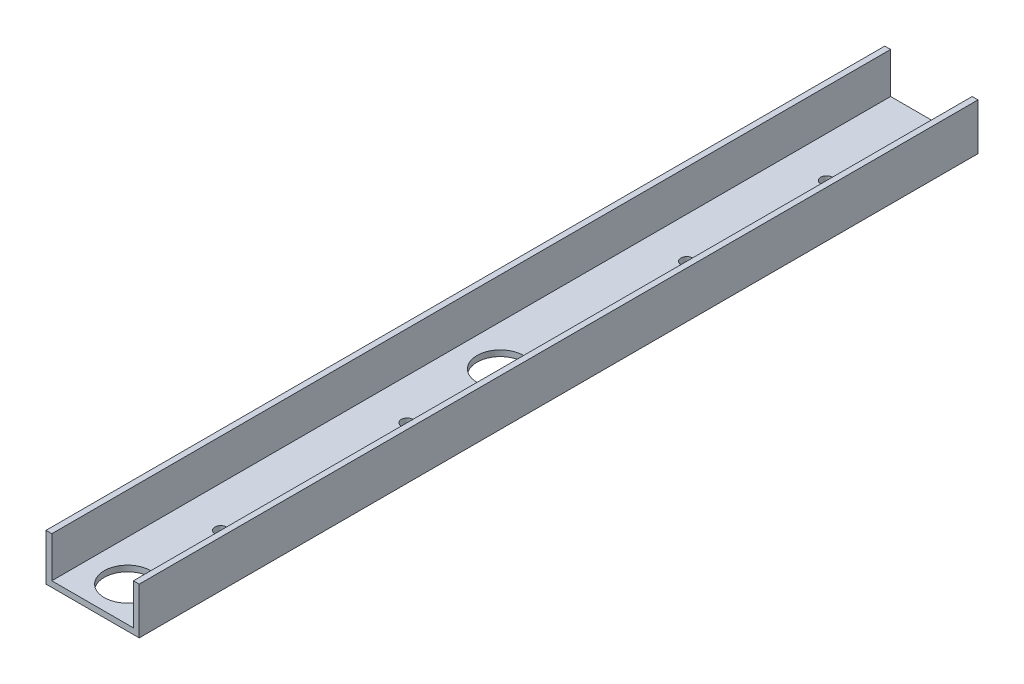
from build123d import *

# Parameters (mm, degrees)
BOSS_EXTRUDE1_DEPTH = 457.2
CUT_EXTRUDE1_REACH  = 462.55
SKETCH2_R           = 12.7
SKETCH2_R_2         = 3.175
CUT_EXTRUDE2_REACH  = 462.55
SKETCH3_R           = 3.175


with BuildPart() as part:
    # Sketch1 → Boss-Extrude1 (new body)
    with BuildSketch(Plane.XY):
        Polygon((47.625, 3.175), (47.625, 25.4), (50.8, 25.4), (50.8, 0), (0, 0), (0, 25.4), (3.175, 25.4), (3.175, 3.175), align=None)
    extrude(amount=BOSS_EXTRUDE1_DEPTH)

    # Sketch2 → Cut-Extrude1 (cut, up to next)
    with BuildSketch(Plane(origin=(0, 3.175, 0), x_dir=(1, 0, 0), z_dir=(0, 1, 0)), mode=Mode.PRIVATE) as cut_extrude1_sk1:
        with Locations((25.4, -438.15)):
            Circle(SKETCH2_R)
    cut_extrude1_tool1 = extrude(cut_extrude1_sk1.sketch, amount=-CUT_EXTRUDE1_REACH, mode=Mode.PRIVATE) & part.part
    # Sketch2 → Cut-Extrude1 (cut, up to next)
    with BuildSketch(Plane(origin=(0, 3.175, 0), x_dir=(1, 0, 0), z_dir=(0, 1, 0)), mode=Mode.PRIVATE) as cut_extrude1_sk2:
        with Locations((25.4, -234.95)):
            Circle(SKETCH2_R)
    cut_extrude1_tool2 = extrude(cut_extrude1_sk2.sketch, amount=-CUT_EXTRUDE1_REACH, mode=Mode.PRIVATE) & part.part
    # Sketch2 → Cut-Extrude1 (cut, up to next)
    with BuildSketch(Plane(origin=(0, 3.175, 0), x_dir=(1, 0, 0), z_dir=(0, 1, 0)), mode=Mode.PRIVATE) as cut_extrude1_sk3:
        with Locations((25.4, -387.35)):
            Circle(SKETCH2_R_2)
    cut_extrude1_tool3 = extrude(cut_extrude1_sk3.sketch, amount=-CUT_EXTRUDE1_REACH, mode=Mode.PRIVATE) & part.part
    # Sketch2 → Cut-Extrude1 (cut, up to next)
    with BuildSketch(Plane(origin=(0, 3.175, 0), x_dir=(1, 0, 0), z_dir=(0, 1, 0)), mode=Mode.PRIVATE) as cut_extrude1_sk4:
        with Locations((25.4, -285.75)):
            Circle(SKETCH2_R_2)
    cut_extrude1_tool4 = extrude(cut_extrude1_sk4.sketch, amount=-CUT_EXTRUDE1_REACH, mode=Mode.PRIVATE) & part.part
    add(cut_extrude1_tool1.solids().sort_by_distance((25.4, 3.175, 438.15))[0], mode=Mode.SUBTRACT)
    add(cut_extrude1_tool2.solids().sort_by_distance((25.4, 3.175, 234.95))[0], mode=Mode.SUBTRACT)
    add(cut_extrude1_tool3.solids().sort_by_distance((25.4, 3.175, 387.35))[0], mode=Mode.SUBTRACT)
    add(cut_extrude1_tool4.solids().sort_by_distance((25.4, 3.175, 285.75))[0], mode=Mode.SUBTRACT)

    # Sketch3 → Cut-Extrude2 (cut, up to next)
    with BuildSketch(Plane(origin=(0, 3.175, 0), x_dir=(1, 0, 0), z_dir=(0, 1, 0)), mode=Mode.PRIVATE) as cut_extrude2_sk1:
        with Locations((25.4, -133.35)):
            Circle(SKETCH3_R)
    cut_extrude2_tool1 = extrude(cut_extrude2_sk1.sketch, amount=-CUT_EXTRUDE2_REACH, mode=Mode.PRIVATE) & part.part
    # Sketch3 → Cut-Extrude2 (cut, up to next)
    with BuildSketch(Plane(origin=(0, 3.175, 0), x_dir=(1, 0, 0), z_dir=(0, 1, 0)), mode=Mode.PRIVATE) as cut_extrude2_sk2:
        with Locations((25.4, -57.15)):
            Circle(SKETCH3_R)
    cut_extrude2_tool2 = extrude(cut_extrude2_sk2.sketch, amount=-CUT_EXTRUDE2_REACH, mode=Mode.PRIVATE) & part.part
    add(cut_extrude2_tool1.solids().sort_by_distance((25.4, 3.175, 133.35))[0], mode=Mode.SUBTRACT)
    add(cut_extrude2_tool2.solids().sort_by_distance((25.4, 3.175, 57.15))[0], mode=Mode.SUBTRACT)


solid = part.part
